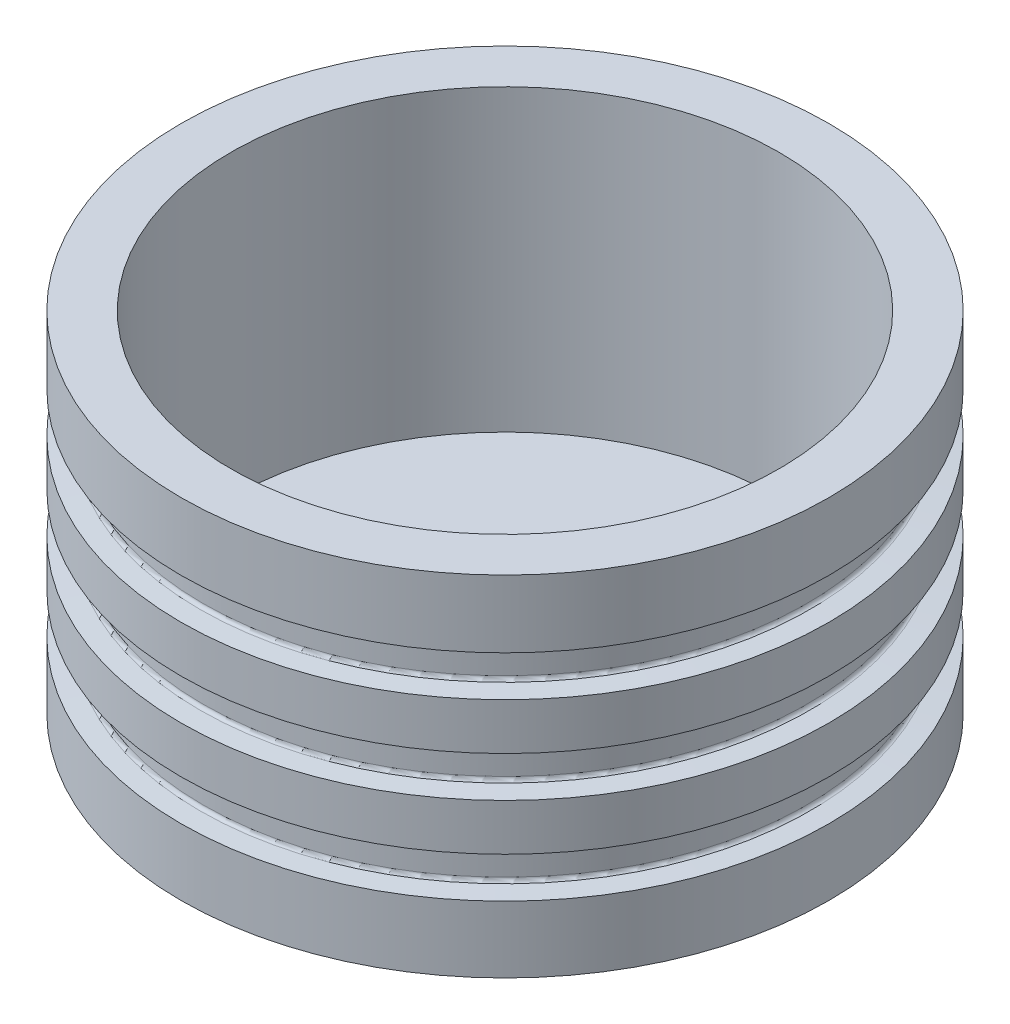
from build123d import *


with BuildPart() as part:
    # Sketch1 → Revolve1 (revolve)
    with BuildSketch(Plane.XY):
        Polygon((-41.275, 0), (-41.275, 44.45), (-34.925, 44.45), (-34.925, 6.35), (-2.82094686, 6.35), (-2.82094686, 0), (-2.82094686, -12.7), (-6.35, -12.7), (-6.35, 0), align=None)
    revolve(axis=Axis((0, 0, 0), (0, 1, 0)))

    # Sketch5 → Groove for AS 568-234, O-Ring1 (revolve, cut)
    with BuildSketch(Plane(origin=(0, 0, 0), x_dir=(0, 0, -1), z_dir=(-1, 0, 0))):
        with BuildLine():
            Line((38.861359272, -30.908756056), (41.3639, -30.689812113))
            Line((41.3639, -30.689812113), (41.3639, -35.8775))
            Line((41.3639, -35.8775), (38.861359272, -35.658556056))
            ThreePointArc((38.861359272, -35.658556056), (38.572380224, -35.51604736), (38.4556, -35.215747513))
            Line((38.4556, -35.215747513), (38.4556, -31.3515646))
            ThreePointArc((38.4556, -31.3515646), (38.572380224, -31.051264752), (38.861359272, -30.908756056))
        make_face()
    revolve(axis=Axis((0, -50, 0), (0, 1, 0)), mode=Mode.SUBTRACT)

    # Sketch7 → Groove for AS 568-234, O-Ring2 (revolve, cut)
    with BuildSketch(Plane(origin=(0, 0, 0), x_dir=(0, 0, -1), z_dir=(-1, 0, 0))):
        with BuildLine():
            Line((38.861359272, -19.796256056), (41.3639, -19.577312113))
            Line((41.3639, -19.577312113), (41.3639, -24.765))
            Line((41.3639, -24.765), (38.861359272, -24.546056056))
            ThreePointArc((38.861359272, -24.546056056), (38.572380224, -24.40354736), (38.4556, -24.103247513))
            Line((38.4556, -24.103247513), (38.4556, -20.2390646))
            ThreePointArc((38.4556, -20.2390646), (38.572380224, -19.938764752), (38.861359272, -19.796256056))
        make_face()
    revolve(axis=Axis((0, -50, 0), (0, 1, 0)), mode=Mode.SUBTRACT)

    # Sketch9 → Groove for AS 568-234, O-Ring3 (revolve, cut)
    with BuildSketch(Plane(origin=(0, 0, 0), x_dir=(0, 0, -1), z_dir=(-1, 0, 0))):
        with BuildLine():
            Line((38.861359272, -8.683756056), (41.3639, -8.464812113))
            Line((41.3639, -8.464812113), (41.3639, -13.6525))
            Line((41.3639, -13.6525), (38.861359272, -13.433556056))
            ThreePointArc((38.861359272, -13.433556056), (38.572380224, -13.29104736), (38.4556, -12.990747513))
            Line((38.4556, -12.990747513), (38.4556, -9.1265646))
            ThreePointArc((38.4556, -9.1265646), (38.572380224, -8.826264752), (38.861359272, -8.683756056))
        make_face()
    revolve(axis=Axis((0, -50, 0), (0, 1, 0)), mode=Mode.SUBTRACT)


solid = part.part
